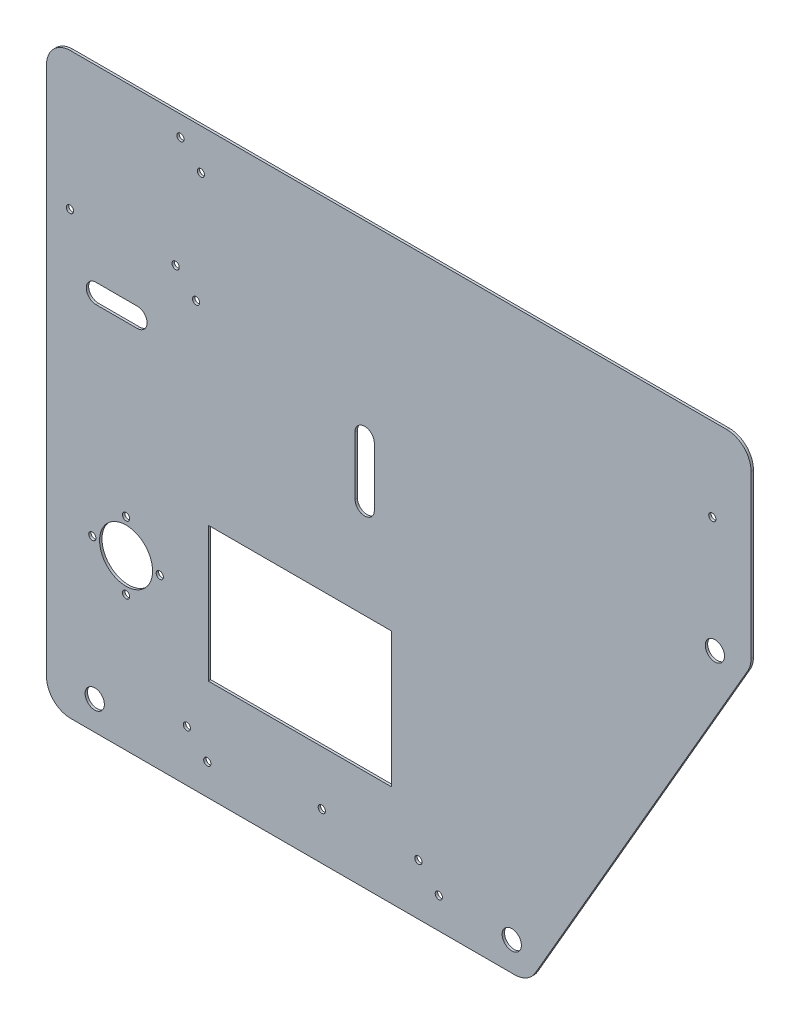
from build123d import *

# Parameters (mm, degrees)
BOSS_EXTRUDE1_DEPTH = 1
SKETCH2_R           = 4
SKETCH2_R_2         = 11
SKETCH2_R_3         = 1.5
SKETCH2_W           = 76
SKETCH2_H           = 56
CUT_EXTRUDE1_DEPTH  = 3
SKETCH3_W           = 292.37604307
SKETCH3_H           = 50
BOSS_EXTRUDE2_DEPTH = 1
FILLET1_R           = 10
SKETCH4_R           = 1.5
CUT_EXTRUDE2_DEPTH  = 11


with BuildPart() as part:
    # Sketch1 → Boss-Extrude1 (new body)
    with BuildSketch(Plane.XY):
        Polygon((-100, 110), (-100, -80), (100, -80), (192.37604307, 80), (192.37604307, 110), align=None)
    extrude(amount=BOSS_EXTRUDE1_DEPTH)

    # Sketch2 → Cut-Extrude1 (cut)
    with BuildSketch(Plane.XY.offset(1)):
        with Locations((93.07179677, -68)):
            Circle(SKETCH2_R)
        with Locations((177.364936071, 78)):
            Circle(SKETCH2_R)
        with Locations((-67, -10)):
            Circle(SKETCH2_R_2)
        with Locations((-80, -68)):
            Circle(SKETCH2_R)
        with Locations((-53, -10)):
            Circle(SKETCH2_R_3)
        with Locations((-67, 4)):
            Circle(SKETCH2_R_3)
        with Locations((-81, -10)):
            Circle(SKETCH2_R_3)
        with Locations((-67, -24)):
            Circle(SKETCH2_R_3)
        with Locations((62.79605759, -67.242640687)):
            Circle(SKETCH2_R_3)
        with Locations((54.310776216, -58.757359313)):
            Circle(SKETCH2_R_3)
        with Locations((-33.274226936, -67.242640687)):
            Circle(SKETCH2_R_3)
        with Locations((-41.75950831, -58.757359313)):
            Circle(SKETCH2_R_3)
        with Locations((14.225855729, -60.5)):
            Circle(SKETCH2_R_3)
        with Locations((-37.93817007, 96.138798421)):
            Circle(SKETCH2_R_3)
        with Locations((-46.423451444, 104.624079796)):
            Circle(SKETCH2_R_3)
        with Locations((-90.295627115, 102.881439108)):
            Circle(SKETCH2_R_3)
        with Locations((176.305585362, 125.488938255)):
            Circle(SKETCH2_R_3)
        with BuildLine():
            Line((-79.516586773, 82), (-62.300333374, 82))
            ThreePointArc((-62.300333374, 82), (-58.300333374, 78), (-62.300333374, 74))
            Line((-62.300333374, 74), (-79.516586773, 74))
            ThreePointArc((-79.516586773, 74), (-83.516586773, 78), (-79.516586773, 82))
        make_face()
        with Locations((5.141640745, -10)):
            Rectangle(SKETCH2_W, SKETCH2_H)
        with BuildLine():
            Line((36.026164778, 82), (36.026164778, 57.777585682))
            ThreePointArc((36.026164778, 57.777585682), (32.026164778, 53.777585682), (28.026164778, 57.777585682))
            Line((28.026164778, 57.777585682), (28.026164778, 82))
            ThreePointArc((28.026164778, 82), (32.026164778, 86), (36.026164778, 82))
        make_face()
    extrude(amount=-CUT_EXTRUDE1_DEPTH, mode=Mode.SUBTRACT)

    # Sketch3 → Boss-Extrude2 (add)
    with BuildSketch(Plane.XY.offset(1)):
        with Locations((46.188021535, 135)):
            Rectangle(SKETCH3_W, SKETCH3_H)
    extrude(amount=-BOSS_EXTRUDE2_DEPTH)

    # Fillet1
    fillet1_edges = [part.edges().sort_by_distance(p)[0] for p in [
        (100, -80, 0.5),
        (-100, -80, 0.5),
        (-100, 160, 0.5),
        (192.37604307, 160, 0.5),
        (192.37604307, 80, 0.5),
    ]]
    fillet(fillet1_edges, radius=FILLET1_R)

    # Sketch4 → Cut-Extrude2 (cut)
    with BuildSketch(Plane.XY.offset(1)):
        with Locations((-44.442274409, 151.624079796)):
            Circle(SKETCH4_R)
        with Locations((-35.956993035, 143.138798421)):
            Circle(SKETCH4_R)
        with Locations((176.305585362, 125.488938255)):
            Circle(SKETCH4_R)
    extrude(amount=-CUT_EXTRUDE2_DEPTH, mode=Mode.SUBTRACT)


solid = part.part
